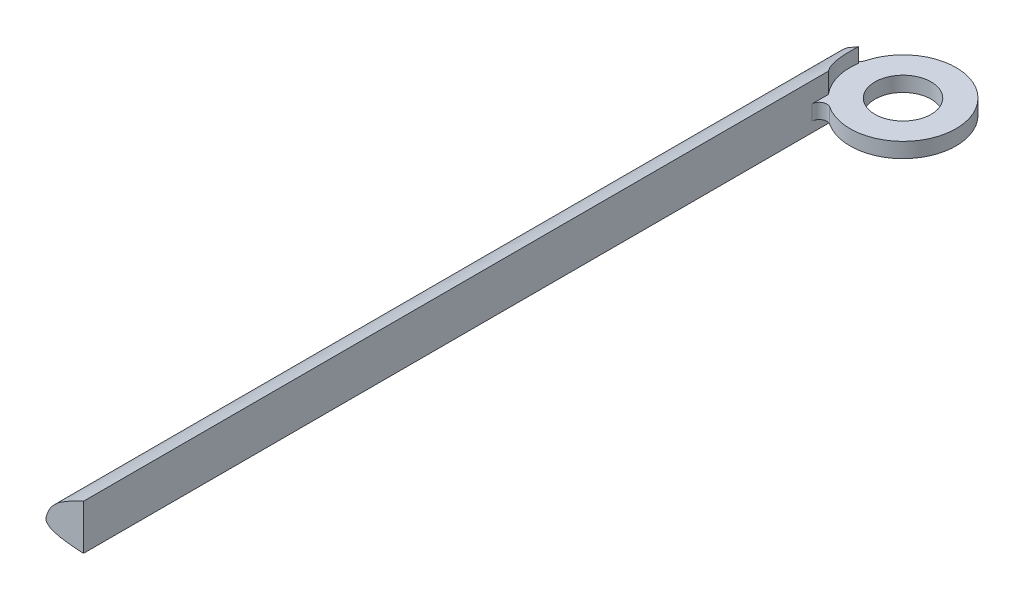
from build123d import *

# Parameters (mm, degrees)
STOCK_AIRFOIL_START                         = 9.964543073
STOCK_AIRFOIL_SWEPT_WING_FX63137_IL_1_DEPTH = 266.7
SKETCH1_R                                   = 17.960512242
SKETCH1_R_2                                 = 9.525
BOSS_EXTRUDE1_DEPTH                         = 5.08
SKETCH1_2_R                                 = 17.960512242
SKETCH1_2_R_2                               = 9.525
CUT_EXTRUDE1_DEPTH                          = 281.454302176
CUT_EXTRUDE2_DEPTH                          = 281.328927111
FILLET1_R                                   = 2.54


# Read off the part's stored shape, not the designer's step: Stock-Airfoil swept wing fx63137-il-1
with BuildPart() as part:
    # Stock-Airfoil swept wing fx63137-il-1 ou → Stock-Airfoil swept wing fx63137-il-1 (new body)
    with BuildSketch(Plane.XY.offset(STOCK_AIRFOIL_START)):
        with BuildLine():
            Line((12.7, -3.391309563), (12.7, 11.919367389))
            add(Edge.make_bspline(
                [(12.7, 11.919367389), (12.107688094, 11.683702249), (10.635574453, 11.079722892), (8.527606142, 9.849717648), (6.279964378, 8.646785603), (4.342242589, 7.40453424), (2.806173618, 5.994247444), (1.516740911, 4.537191471), (0.712524386, 2.969827744), (0.263531395, 1.765317826), (0.043146734, 1.059554456), (1.8e-08, 0.851361022)],
                knots=[0.45638464, 0.45638464, 0.45638464, 0.45638464, 0.462044499, 0.470525623, 0.478015714, 0.484719936, 0.490901449, 0.496493482, 0.50193463, 0.506331604, 0.508170451, 0.508170451, 0.508170451, 0.508170451], degree=3))
            Line((1.8e-08, 0.851361022), (0, 0))
            add(Edge.make_bspline(
                [(0, 0), (0.037678235, -0.133203376), (0.20695929, -0.498579461), (0.796648481, -0.996478044), (1.562726639, -1.751510363), (2.908334343, -2.048005045), (4.404594059, -2.615055976), (6.334240311, -2.748450405), (8.514951674, -3.154891292), (10.691274683, -3.217102669), (12.115175856, -3.344316823), (12.7, -3.391309563)],
                knots=[0.510717667, 0.510717667, 0.510717667, 0.510717667, 0.511954045, 0.514195842, 0.517506907, 0.521314719, 0.52610709, 0.531740963, 0.538337761, 0.545822104, 0.551036832, 0.551036832, 0.551036832, 0.551036832], degree=3))
        make_face()
    extrude(amount=STOCK_AIRFOIL_SWEPT_WING_FX63137_IL_1_DEPTH)

    # Sketch1 → Boss-Extrude1 (add)
    with BuildSketch(Plane(origin=(0, 0, 0), x_dir=(1, 0, 0), z_dir=(0, 1, 0))):
        with Locations((26.416, -12.7)):
            Circle(SKETCH1_R)
        with Locations(Location((26.416, -12.7, 0), (0, 0, 270))):
            Circle(SKETCH1_R_2, mode=Mode.SUBTRACT)
    extrude(amount=BOSS_EXTRUDE1_DEPTH)

    # Sketch1<2> → Cut-Extrude1 (cut, through all)
    with BuildSketch(Plane(origin=(0, 0, 0), x_dir=(1, 0, 0), z_dir=(0, 1, 0))):
        with Locations((26.416, -12.7)):
            Circle(SKETCH1_2_R)
        with Locations(Location((26.416, -12.7, 0), (0, 0, 270))):
            Circle(SKETCH1_2_R_2, mode=Mode.SUBTRACT)
    extrude(amount=-CUT_EXTRUDE1_DEPTH, mode=Mode.SUBTRACT)

    # Sketch2 → Cut-Extrude2 (cut, through all)
    with BuildSketch(Plane(origin=(0, 5.08, 0), x_dir=(1, 0, 0), z_dir=(0, 1, 0))):
        with BuildLine():
            Line((12.7, -24.295315606), (12.7, -9.964543073))
            Line((12.7, -9.964543073), (8.665020438, -9.964543073))
            ThreePointArc((8.665020438, -9.964543073), (9.127695831, -17.567703665), (12.7, -24.295315606))
        make_face()
    extrude(amount=CUT_EXTRUDE2_DEPTH, mode=Mode.SUBTRACT)

    # Fillet1
    fillet1_edges = [part.edges().sort_by_distance(p)[0] for p in [
        (8.665020438, 2.54, 9.964543073),
        (12.7, 2.54, 24.295315606),
    ]]
    fillet(fillet1_edges, radius=FILLET1_R)


solid = part.part
